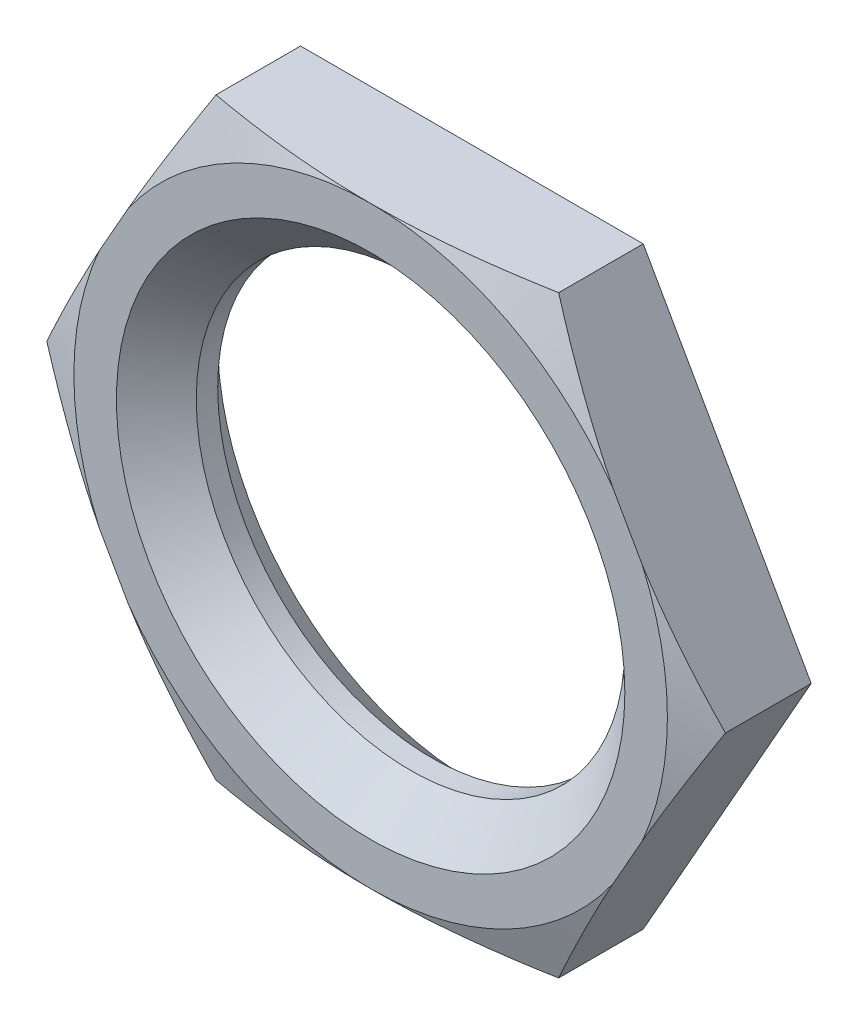
from build123d import *

# Parameters (mm, degrees)
CUT_EXTRUDE1_DEPTH      = 2.3876
CUT_EXTRUDE1_DEPTH_BACK = 2.3876
SKETCH2_W               = 27.9908
SKETCH2_H               = 27.9908


with BuildPart() as part:
    # Sketch1 → Revolve1 (revolve)
    with BuildSketch(Plane(origin=(0, 0, 0), x_dir=(0, 0, -1), z_dir=(1, 0, 0))):
        Polygon((-1.1938, 0), (-1.1938, 6.9977), (-0.684409098, 8.39724), (1.1938, 8.39724), (1.1938, 0), align=None)
    revolve(axis=Axis((0, 0, -1.1938), (0, 0, 1)))

    # Sketch2 → Cut-Extrude1 (cut, two sides: drawn at the far end of the back side and taken through both)
    with BuildSketch(Plane.XY.offset(-CUT_EXTRUDE1_DEPTH_BACK)):
        Rectangle(SKETCH2_W, SKETCH2_H)
        Polygon((-8.001, 0), (-4.040123979, -6.9977), (4.040123979, -6.9977), (8.001, 0), (4.040123979, 6.9977), (-4.040123979, 6.9977), align=None, mode=Mode.SUBTRACT)
    extrude(amount=CUT_EXTRUDE1_DEPTH + CUT_EXTRUDE1_DEPTH_BACK, mode=Mode.SUBTRACT)

    # Sketch3 → Cut-Revolve1 (revolve, cut)
    with BuildSketch(Plane(origin=(0, 0, 0), x_dir=(0, 0, -1), z_dir=(1, 0, 0))):
        Polygon((-1.1938, 0), (-1.1938, 5.9944), (-0.2524, 5.053), (0.2524, 5.053), (1.1938, 5.9944), (1.1938, 0), align=None)
    revolve(axis=Axis((0, 0, -1.1938), (0, 0, 1)), mode=Mode.SUBTRACT)


solid = part.part
